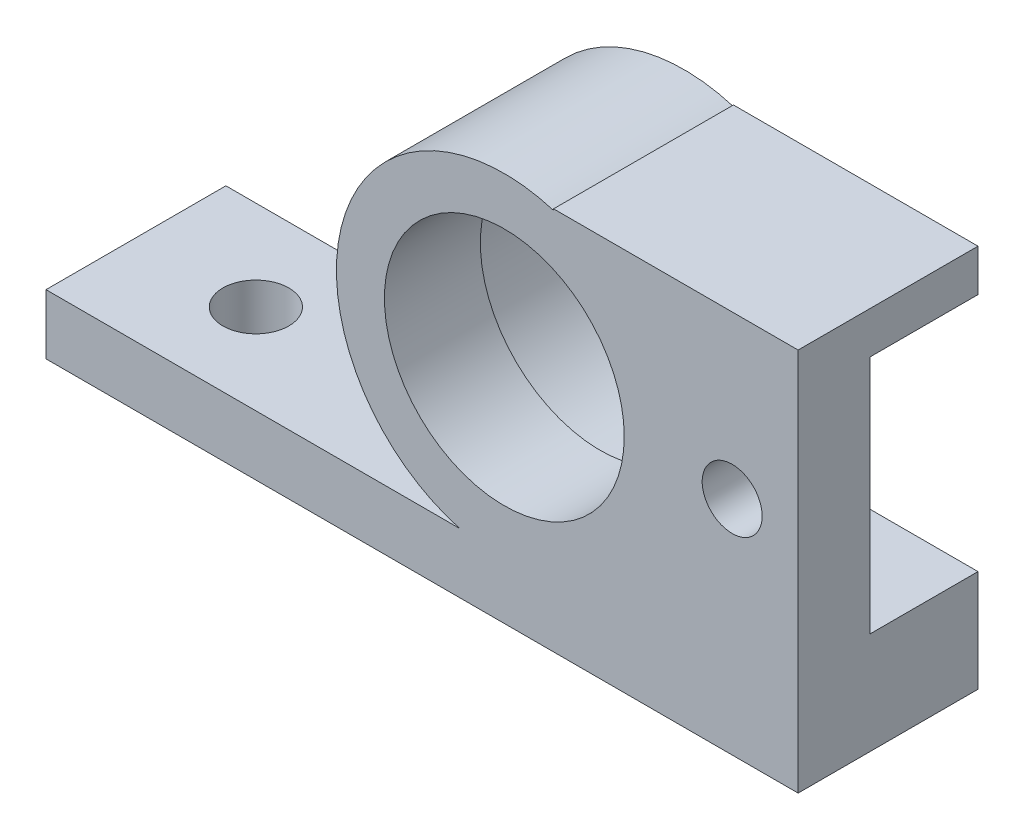
from build123d import *

# Parameters (mm, degrees)
SKETCH_1_W          = 40
SKETCH_1_H          = 20
EXTRUDE_1_DEPTH     = 6
SKETCH_2_R          = 2.5
CUT_EXTRUDE_1_DEPTH = 24.151673806
EXTRUDE_START       = -15
EXTRUDE_2_OUTLINE_R = 11
EXTRUDE_2_DEPTH     = 15
EXTRUDE_START_2     = -8
SKETCH_5_R          = 11
SKETCH_5_R_2        = 10
EXTRUDE_3_DEPTH     = 8
SKETCH_10_W         = 15
SKETCH_10_H         = 5
EXTRUDE_4_DEPTH     = 500
SKETCH_11_W         = 11.491200589
SKETCH_11_H         = 5.122583395
EXTRUDE_5_DEPTH     = 15
SKETCH_12_W         = 26.5
SKETCH_12_H         = 32
CUT_EXTRUDE_2_DEPTH = 481.59052217
SKETCH_14_W         = 424.807672393
SKETCH_14_H         = 21.861471412
CUT_EXTRUDE_3_DEPTH = 482.183177179
SKETCH_15_R         = 2.75
CUT_EXTRUDE_4_DEPTH = 10


# Read off the part's stored shape, not the designer's step: 凸台-拉伸2
with BuildPart() as part:
    # 草图1 → 凸台-拉伸1 (new body)
    with BuildSketch(Plane.XY):
        Rectangle(SKETCH_1_W, SKETCH_1_H)
    extrude(amount=EXTRUDE_1_DEPTH)

    # 草图2 → 切除-拉伸1 (cut, through all)
    with BuildSketch(Plane.XY.offset(6)):
        with Locations((10, 0)):
            Circle(SKETCH_2_R)
        with Locations((-1, 0)):
            Circle(SKETCH_2_R)
        with Locations((-12, 0)):
            Circle(SKETCH_2_R)
    extrude(amount=-CUT_EXTRUDE_1_DEPTH, mode=Mode.SUBTRACT)

    # 凸台-拉伸2 outline → 凸台-拉伸2 (add)
    with BuildSketch(Plane.XY.offset(6).offset(EXTRUDE_START)):
        with BuildLine():
            Line((20, 10), (20, 13.5))
            Line((20, 13.5), (-26.893967141, 13.5))
            Line((-26.893967141, 13.5), (-26.893967141, 13.384337644))
            ThreePointArc((-26.893967141, 13.384337644), (-45, 0), (-26.893967141, -13.384337644))
            Line((-26.893967141, -13.384337644), (-26.893967141, -13.5))
            Line((-26.893967141, -13.5), (20, -13.5))
            Line((20, -13.5), (20, -10))
            Line((20, -10), (-20, -10))
            Line((-20, -10), (-20, -8.660254038))
            ThreePointArc((-20, -8.660254038), (-17, 0), (-20, 8.660254038))
            Line((-20, 8.660254038), (-20, 10))
            Line((-20, 10), (20, 10))
        make_face()
        with Locations((-31, 0)):
            Circle(EXTRUDE_2_OUTLINE_R, mode=Mode.SUBTRACT)
    extrude(amount=EXTRUDE_2_DEPTH)

    # 草图5 → 凸台-拉伸3 (add)
    with BuildSketch(Plane.XY.offset(6).offset(EXTRUDE_START_2)):
        with Locations((-31, 0)):
            Circle(SKETCH_5_R)
        with Locations((-31, 0)):
            Circle(SKETCH_5_R_2, mode=Mode.SUBTRACT)
    extrude(amount=EXTRUDE_3_DEPTH)

    # 草图10 → 凸台-拉伸4 (add)
    with BuildSketch(Plane(origin=(20, 0, 0), x_dir=(0, 0, -1), z_dir=(1, 0, 0))):
        with Locations((1.5, -16)):
            Rectangle(SKETCH_10_W, SKETCH_10_H)
    extrude(amount=-EXTRUDE_4_DEPTH)

    # 草图11 → 凸台-拉伸5 (add, through all)
    with BuildSketch(Plane(origin=(0, 0, -9), x_dir=(-1, 0, 0), z_dir=(0, 0, -1))):
        with Locations((27.78271332, -13.925059853)):
            Rectangle(SKETCH_11_W, SKETCH_11_H)
    extrude(amount=-EXTRUDE_5_DEPTH)

    # 草图12 → 切除-拉伸2 (cut, through all)
    with BuildSketch(Plane.XY.offset(6)):
        with Locations((6.75, -2.5)):
            Rectangle(SKETCH_12_W, SKETCH_12_H)
    extrude(amount=-CUT_EXTRUDE_2_DEPTH, mode=Mode.SUBTRACT)

    # 草图14 → 切除-拉伸3 (cut, through all)
    with BuildSketch(Plane.XZ.offset(18.5)):
        with Locations((-281.623673677, 1.881654976)):
            Rectangle(SKETCH_14_W, SKETCH_14_H)
    extrude(amount=-CUT_EXTRUDE_3_DEPTH, mode=Mode.SUBTRACT)

    # 草图15 → 切除-拉伸4 (cut)
    with BuildSketch(Plane.XZ.offset(18.5)):
        with Locations(Location((-59.219837481, -1.5, 0), (0, 0, 270))):
            Circle(SKETCH_15_R)
    extrude(amount=-CUT_EXTRUDE_4_DEPTH, mode=Mode.SUBTRACT)


solid = part.part
